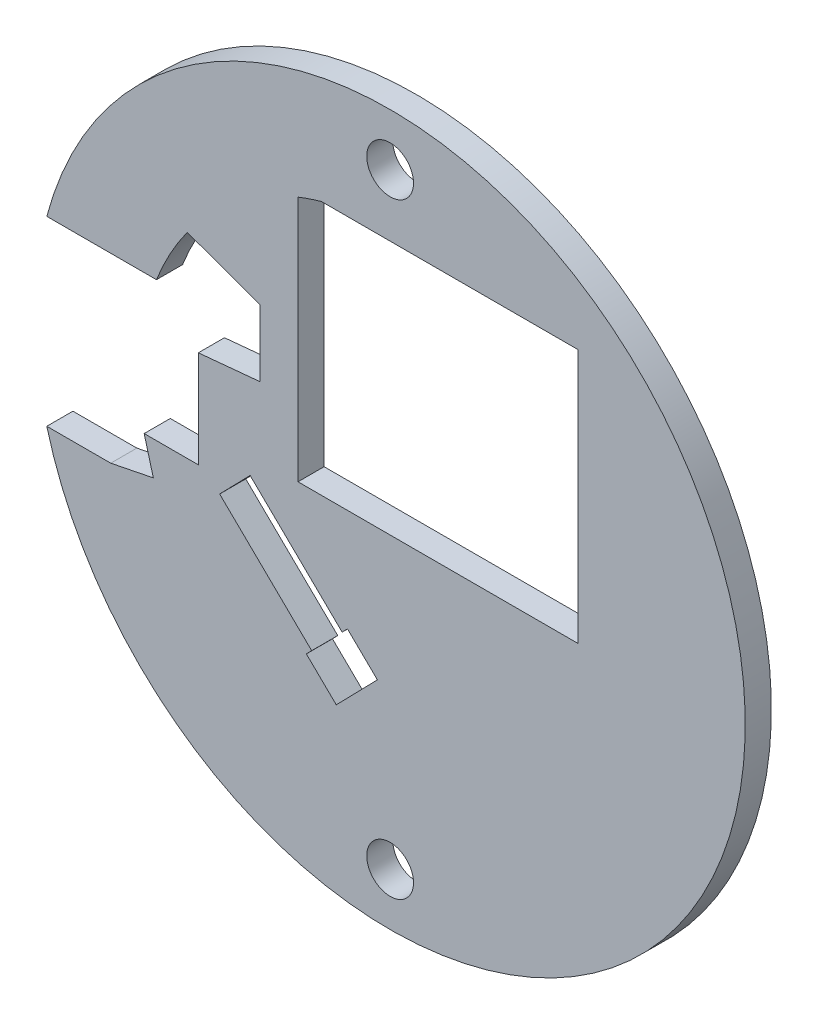
from build123d import *

# Parameters (mm, degrees)
SKETCH1_R           = 1.4224
BOSS_EXTRUDE2_DEPTH = 1.5875


with BuildPart() as part:
    # Sketch1 → Boss-Extrude2 (new body)
    with BuildSketch(Plane.XY):
        with BuildLine():
            Line((-7.9248, 3.302), (-11.65986156, 2.948480848))
            Line((-11.65986156, 2.948480848), (-11.65986156, -2.948480848))
            Line((-11.65986156, -2.948480848), (-14.952058744, -2.948480848))
            Line((-14.952058744, -2.948480848), (-14.395123673, -5.0038))
            Line((-14.395123673, -5.0038), (-16.984058744, -5.5245))
            Line((-16.984058744, -5.5245), (-20.871224203, -5.5245))
            ThreePointArc((-20.871224203, -5.5245), (21.59, 0), (-20.871224203, 5.5245))
            Line((-20.871224203, 5.5245), (-14.203432675, 5.5245))
            ThreePointArc((-14.203432675, 5.5245), (-13.378320264, 7.299188099), (-12.332576282, 8.9535))
            Line((-12.332576282, 8.9535), (-7.9248, 7.366))
            Line((-7.9248, 7.366), (-7.9248, 3.302))
        make_face()
        with BuildLine():
            Line((-5.6007, -0.8128), (-5.6007, 14.173558463))
            ThreePointArc((-5.6007, 14.173558463), (-4.895856129, 14.43219293), (-4.179129857, 14.6558))
            Line((-4.179129857, 14.6558), (4.179129857, 14.6558))
            Line((4.179129857, 14.6558), (11.43, 14.6558))
            Line((11.43, 14.6558), (11.43, -0.8128))
            Line((11.43, -0.8128), (-5.6007, -0.8128))
        make_face(mode=Mode.SUBTRACT)
        Polygon((-2.594132624, -7.054138602), (-0.7747, -8.8265), (-3.273729572, -11.3919), (-5.093162196, -9.619538602), (-4.769706241, -9.287492148), (-10.36446156, -3.837480848), (-8.512343898, -1.936173756), (-2.917588579, -7.386185056), align=None, mode=Mode.SUBTRACT)
        with Locations((0, 18.415)):
            Circle(SKETCH1_R, mode=Mode.SUBTRACT)
        with Locations((0, -18.415)):
            Circle(SKETCH1_R, mode=Mode.SUBTRACT)
    extrude(amount=BOSS_EXTRUDE2_DEPTH)


solid = part.part
